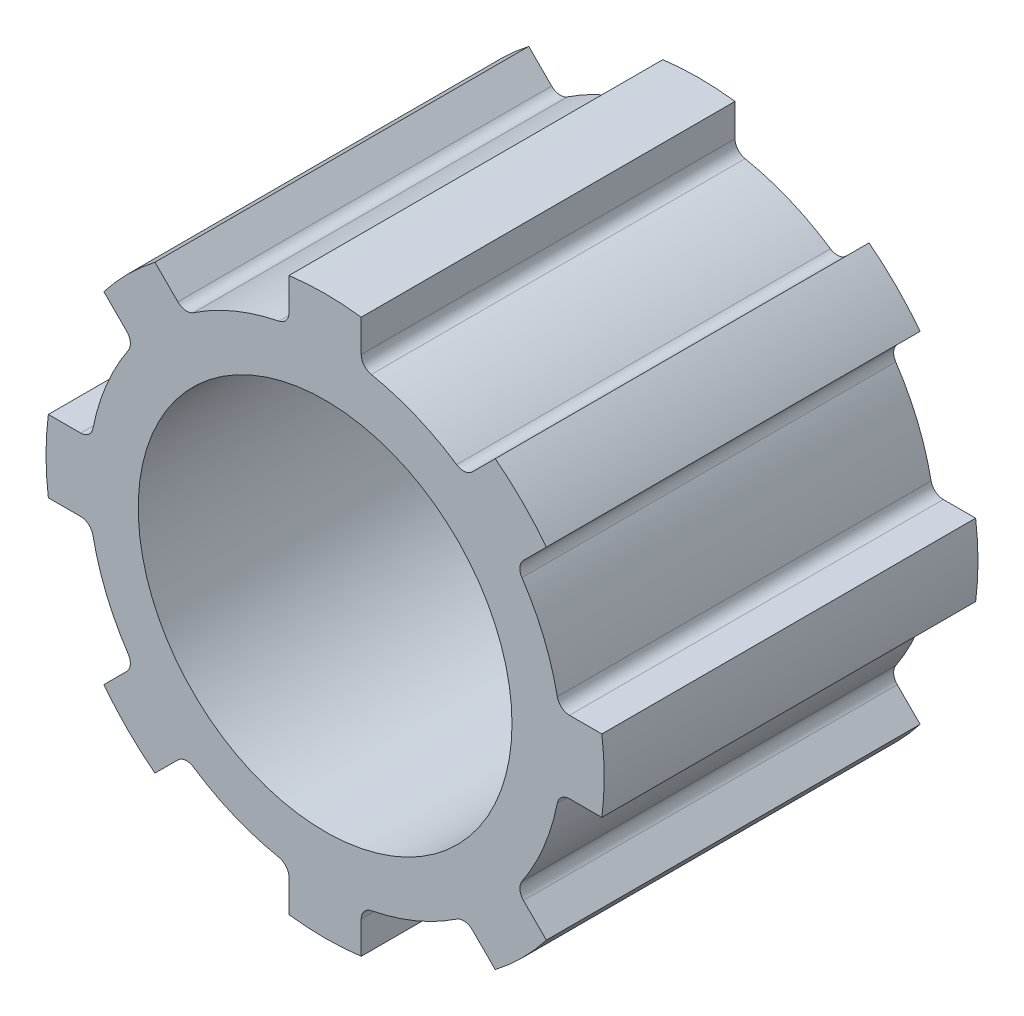
from build123d import *

# Parameters (mm, degrees)
SKETCH_2_W                       = 60
SKETCH_2_H                       = 14.8
CUT_EXTRUDE_1_DEPTH              = 88.258695842
FILLET_2_R                       = 2
PATTERN_CIRCULAR_1_COUNT         = 8
FILLET_2_OF_PATTERN_CIRCULAR_1_R = 2


with BuildPart() as part:
    # Эскиз2 → Повернуть1 (revolve)
    with BuildSketch(Plane(origin=(0, 0, 0), x_dir=(0, 0, -1), z_dir=(1, 0, 0))):
        with Locations((30, 37.4)):
            Rectangle(SKETCH_2_W, SKETCH_2_H)
    revolve(axis=Axis((0, 0, 0), (0, 0, -1)))

    # Эскиз4 → Вырез-Вытянуть1 (cut, through all)
    with BuildSketch(Plane.XY):
        with BuildLine():
            Line((-5.8, 37.554760018), (-5.8, 44.422967033))
            ThreePointArc((-5.8, 44.422967033), (-11.571918734, 43.279679953), (-17.14421777, 41.389803057))
            Line((-17.14421777, 41.389803057), (-14.54197043, 35.107422235))
            ThreePointArc((-14.54197043, 35.107422235), (-10.244330422, 36.5930826), (-5.8, 37.554760018))
        make_face()
        with BuildLine():
            Line((5.8, 37.554760018), (5.8, 44.422967033))
            ThreePointArc((5.8, 44.422967033), (11.571918734, 43.279679953), (17.14421777, 41.389803057))
            Line((17.14421777, 41.389803057), (14.54197043, 35.107422235))
            ThreePointArc((14.54197043, 35.107422235), (10.244330422, 36.5930826), (5.8, 37.554760018))
        make_face()
    cut_extrude_1 = extrude(amount=-CUT_EXTRUDE_1_DEPTH, mode=Mode.SUBTRACT)

    # Скругление2
    fillet_2_edges = [part.edges().sort_by_distance(p)[0] for p in [
        (5.8, 37.554760018, -30),
        (-5.8, 37.554760018, -30),
    ]]
    fillet(fillet_2_edges, radius=FILLET_2_R)

    # Круговой массив1: Вырез-Вытянуть1 ×8 about axis
    pattern_circular_1_axis = Axis((0, 0, 0), (0, 0, 1))
    for i in range(1, PATTERN_CIRCULAR_1_COUNT):
        add(cut_extrude_1.rotate(pattern_circular_1_axis, i * 360 / PATTERN_CIRCULAR_1_COUNT), mode=Mode.SUBTRACT)

    # Скругление2 of Круговой массив1
    fillet_2_of_pattern_circular_1_edges = [part.edges().sort_by_distance(p)[0] for p in [
        (-22.454006144, 30.656444805, -30),
        (-30.656444805, 22.454006144, -30),
        (-37.554760018, 5.8, -30),
        (-37.554760018, -5.8, -30),
        (-30.656444805, -22.454006144, -30),
        (-22.454006144, -30.656444805, -30),
        (-5.8, -37.554760018, -30),
        (5.8, -37.554760018, -30),
        (22.454006144, -30.656444805, -30),
        (30.656444805, -22.454006144, -30),
        (37.554760018, -5.8, -30),
        (37.554760018, 5.8, -30),
        (30.656444805, 22.454006144, -30),
        (22.454006144, 30.656444805, -30),
    ]]
    fillet(fillet_2_of_pattern_circular_1_edges, radius=FILLET_2_OF_PATTERN_CIRCULAR_1_R)


solid = part.part
